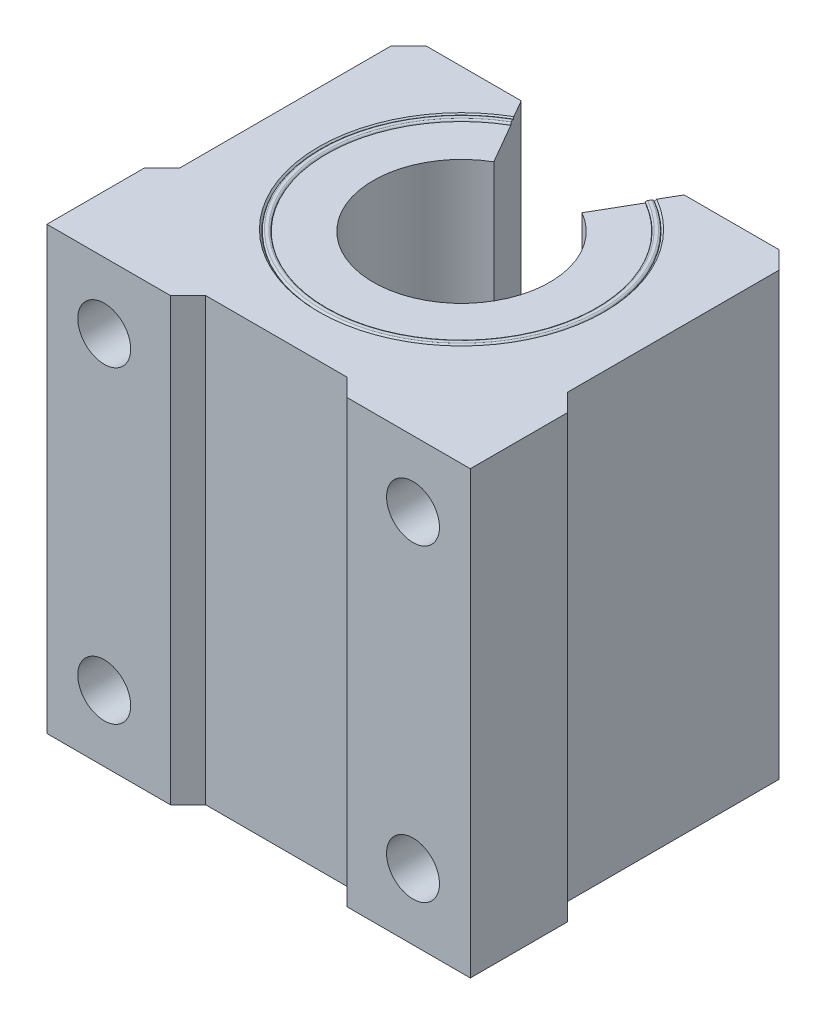
from build123d import *

# Parameters (mm, degrees)
EXTRUDE_2_DEPTH     = 50
CHAMFER_1_SIZE      = 2
SKETCH_5_R          = 3
CUT_EXTRUDE_1_DEPTH = 12
CHAMFER_2_SIZE      = 2


with BuildPart() as part:
    # 草图4 → 拉伸2 (new body)
    with BuildSketch(Plane(origin=(0, -25, 0), x_dir=(-1, 0, 0), z_dir=(0, 1, 0))):
        with BuildLine():
            Line((8, 21), (-8, 21))
            Line((-8, 21), (-8, 23))
            Line((-8, 23), (-24, 23))
            Line((-24, 23), (-24, 12))
            Line((-24, 12), (-22, 10))
            Line((-22, 10), (-22, -16))
            Line((-22, -16), (-9.237604307, -16))
            Line((-9.237604307, -16), (-5, -8.660254038))
            ThreePointArc((-5, -8.660254038), (0, 10), (5, -8.660254038))
            Line((5, -8.660254038), (9.237604307, -16))
            Line((9.237604307, -16), (22, -16))
            Line((22, -16), (22, 10))
            Line((22, 10), (24, 12))
            Line((24, 12), (24, 23))
            Line((24, 23), (8, 23))
            Line((8, 23), (8, 21))
        make_face()
    extrude(amount=EXTRUDE_2_DEPTH)

    # 倒角1
    chamfer_1_edges = [part.edges().sort_by_distance(p)[0] for p in [
        (-8, 0, 23),
        (8, 0, 23),
    ]]
    chamfer(chamfer_1_edges, length=CHAMFER_1_SIZE - 0.0001)  # a hair under: the kernel refuses the full size

    # 草图5 → 切除-拉伸1 (cut)
    with BuildSketch(Plane.XY.offset(23)):
        with Locations((-17.5, 17.5)):
            Circle(SKETCH_5_R)
        with Locations((17.5, 17.5)):
            Circle(SKETCH_5_R)
        with Locations((17.5, -17.5)):
            Circle(SKETCH_5_R)
        with Locations((-17.5, -17.5)):
            Circle(SKETCH_5_R)
    extrude(amount=-CUT_EXTRUDE_1_DEPTH, mode=Mode.SUBTRACT)

    # 倒角2
    chamfer_2_edges = [part.edges().sort_by_distance(p)[0] for p in [
        (-22, 0, -16),
        (22, 0, -16),
    ]]
    chamfer(chamfer_2_edges, length=CHAMFER_2_SIZE)

    # 草图6 → 切除-旋转1 (revolve, cut)
    with BuildSketch(Plane(origin=(0, 0, 0), x_dir=(0, 0, -1), z_dir=(1, 0, 0))):
        with BuildLine():
            Line((-16.2, -25), (-16, -24.8))
            ThreePointArc((-16, -24.8), (-15.940621125, -24.941496067), (-15.798761062, -25))
            Line((-15.798761062, -25), (-16.2, -25))
        make_face()
        with BuildLine():
            Line((-15.45, -25), (0, -25))
            Line((0, -25), (0, -24.8))
            Line((0, -24.8), (-15.25, -24.8))
            ThreePointArc((-15.25, -24.8), (-15.308578644, -24.941421356), (-15.45, -25))
        make_face()
    cut_revolve_1 = revolve(axis=Axis((0, -10.264906919, 0), (0, -1, 0)), mode=Mode.SUBTRACT)

    # 镜向1: 切除-旋转1 across plane
    add(cut_revolve_1.mirror(Plane.ZX), mode=Mode.SUBTRACT)


solid = part.part
